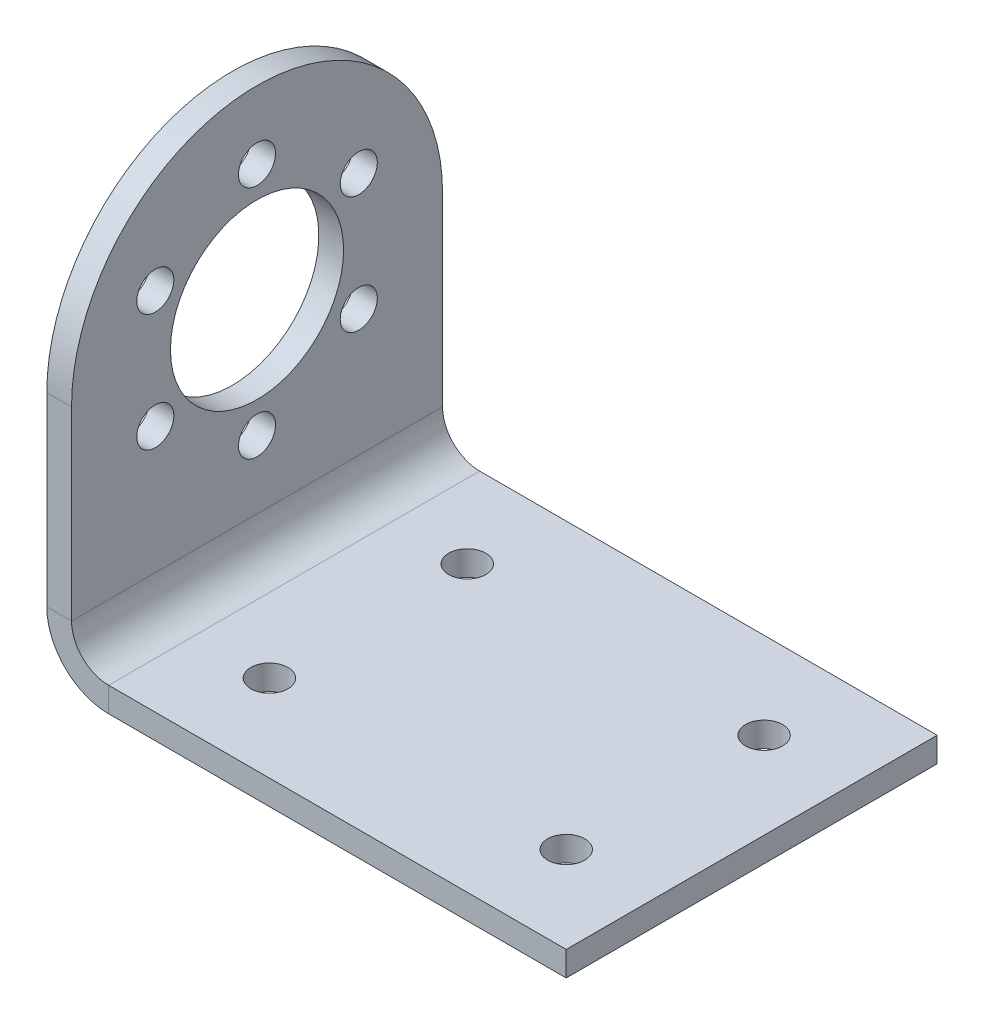
from build123d import *

# Parameters (mm, degrees)
SM_BASE_FLANGE_1_DEPTH = 30
SKETCH_4_R             = 7
SKETCH_4_R_2           = 1.5
CUT_EXTRUDE_1_DEPTH    = 10
SKETCH_5_R             = 1.5
CUT_EXTRUDE_2_DEPTH    = 10


# Sheet-metal steps are written as plain solids
with BuildPart() as part:
    # Sketch 1 → 基体-法兰1 (new body)
    with BuildSketch(Plane.XY):
        with BuildLine():
            Line((-47.024221453, 21.737024221), (-47.024221453, -8.262975779))
            ThreePointArc((-47.024221453, -8.262975779), (-46.145541797, -10.384296122), (-44.024221453, -11.262975779))
            Line((-44.024221453, -11.262975779), (-7.024221453, -11.262975779))
            Line((-7.024221453, -11.262975779), (-7.024221453, -13.262975779))
            Line((-7.024221453, -13.262975779), (-44.024221453, -13.262975779))
            ThreePointArc((-44.024221453, -13.262975779), (-47.559755359, -11.798509684), (-49.024221453, -8.262975779))
            Line((-49.024221453, -8.262975779), (-49.024221453, 21.737024221))
            Line((-49.024221453, 21.737024221), (-47.024221453, 21.737024221))
        make_face()
    extrude(amount=SM_BASE_FLANGE_1_DEPTH)

    # 草图4 → 切除-拉伸1 (cut)
    with BuildSketch(Plane.ZY.offset(49.024221453)):
        with Locations((15, 6.737024221)):
            Circle(SKETCH_4_R)
        with Locations((6.772758664, 11.487024221)):
            Circle(SKETCH_4_R_2)
        with Locations((6.772758664, 1.987024221)):
            Circle(SKETCH_4_R_2)
        with Locations((15, -2.762975779)):
            Circle(SKETCH_4_R_2)
        with Locations((23.227241336, 1.987024221)):
            Circle(SKETCH_4_R_2)
        with Locations((23.227241336, 11.487024221)):
            Circle(SKETCH_4_R_2)
        with Locations((15, 16.237024221)):
            Circle(SKETCH_4_R_2)
        with BuildLine():
            Line((30, 21.737024221), (15, 21.737024221))
            ThreePointArc((15, 21.737024221), (25.606601718, 17.343625939), (30, 6.737024221))
            Line((30, 6.737024221), (30, 21.737024221))
        make_face()
        with BuildLine():
            Line((0, 21.737024221), (0, 6.737024221))
            ThreePointArc((0, 6.737024221), (4.393398282, 17.343625939), (15, 21.737024221))
            Line((15, 21.737024221), (0, 21.737024221))
        make_face()
    extrude(amount=-CUT_EXTRUDE_1_DEPTH, mode=Mode.SUBTRACT)

    # 草图5 → 切除-拉伸2 (cut)
    with BuildSketch(Plane(origin=(0, -11.262975779, 0), x_dir=(1, 0, 0), z_dir=(0, 1, 0))):
        with Locations(Location((-38.024221453, -23, 0), (0, 0, 270))):
            Circle(SKETCH_5_R)
        with Locations(Location((-38.024221453, -7, 0), (0, 0, 270))):
            Circle(SKETCH_5_R)
        with Locations(Location((-14.024221453, -23, 0), (0, 0, 270))):
            Circle(SKETCH_5_R)
        with Locations(Location((-14.024221453, -7, 0), (0, 0, 270))):
            Circle(SKETCH_5_R)
    extrude(amount=-CUT_EXTRUDE_2_DEPTH, mode=Mode.SUBTRACT)


solid = part.part
